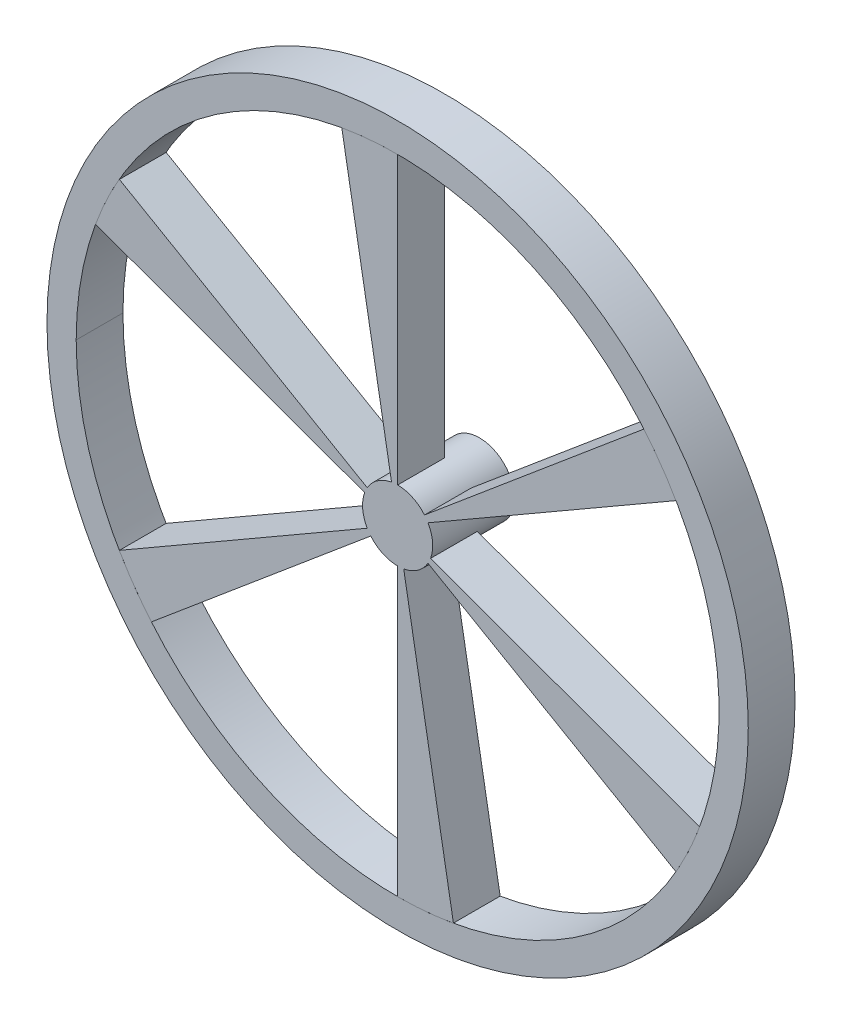
from build123d import *

# Parameters (mm, degrees)
EXTRUDE_8_OUTLINE_R = 300
EXTRUDE_8_DEPTH     = 40
EXTRUDE_START       = 30
SKETCH_2_R          = 30
EXTRUDE_9_DEPTH     = 30


# Read off the part's stored shape, not the designer's step: 凸台-拉伸8
with BuildPart() as part:
    # 凸台-拉伸8 outline → 凸台-拉伸8 (new body)
    # profile 1 of 2: a face of its own
    with BuildSketch(Plane.XY):
        Circle(EXTRUDE_8_OUTLINE_R)
        with BuildLine():
            ThreePointArc((194.455864826, 194.454864826), (275.002, 0), (194.455864826, -194.454864826))
            ThreePointArc((194.455864826, -194.454864826), (-105.237079199, -254.067815398), (-274.998999998, 0))
            ThreePointArc((-274.998999998, 0), (-105.237079199, 254.067815398), (194.455864826, 194.454864826))
        make_face(mode=Mode.SUBTRACT)
    # profile 2 of 2: a face of its own
    with BuildSketch(Plane.XY):
        with BuildLine():
            Line((0.001, 29.999999983), (0.001, 274.999))
            ThreePointArc((0.001, 274.999), (-23.966252232, 273.952592458), (-47.751108002, 270.82133324))
            Line((-47.751108002, 270.82133324), (-5.207505626, 29.544574547))
            ThreePointArc((-5.207505626, 29.544574547), (-17.206076786, 24.575412949), (-25.980262099, 15.000866017))
            Line((-25.980262099, 15.000866017), (-238.154986041, 137.5))
            ThreePointArc((-238.154986041, 137.5), (-249.232369781, 116.220604542), (-258.413031021, 94.056747459))
            Line((-258.413031021, 94.056747459), (-28.190104915, 10.262455111))
            ThreePointArc((-28.190104915, 10.262455111), (-29.885970316, -2.613193121), (-25.981262099, -14.999133966))
            Line((-25.981262099, -14.999133966), (-238.155986034, -137.498267946))
            ThreePointArc((-238.155986034, -137.498267946), (-225.266319296, -157.73136759), (-210.662314239, -176.764099031))
            Line((-210.662314239, -176.764099031), (-22.982599288, -19.282119436))
            ThreePointArc((-22.982599288, -19.282119436), (-12.679893529, -27.188606071), (-0.001, -29.999999983))
            Line((-0.001, -29.999999983), (-0.001, -274.998999993))
            ThreePointArc((-0.001, -274.998999993), (23.966274976, -273.952765434), (47.751168306, -270.821675245))
            Line((47.751168306, -270.821675245), (5.207505626, -29.544574547))
            ThreePointArc((5.207505626, -29.544574547), (17.206076786, -24.575412949), (25.980262099, -15.000866017))
            Line((25.980262099, -15.000866017), (238.156803019, -137.501049033))
            ThreePointArc((238.156803019, -137.501049033), (249.234454424, -116.221567498), (258.415358678, -94.057594657))
            Line((258.415358678, -94.057594657), (28.190104915, -10.262455111))
            ThreePointArc((28.190104915, -10.262455111), (29.885970316, 2.613193121), (25.981262099, 14.999133966))
            Line((25.981262099, 14.999133966), (238.157803028, 137.499316987))
            ThreePointArc((238.157803028, 137.499316987), (225.267868034, 157.732440228), (210.663582322, 176.765163078))
            Line((210.663582322, 176.765163078), (22.982599288, 19.282119436))
            ThreePointArc((22.982599288, 19.282119436), (12.679893529, 27.188606071), (0.001, 29.999999983))
        make_face()
    extrude(amount=EXTRUDE_8_DEPTH)

    # 草图2 → 凸台-拉伸9 (add)
    with BuildSketch(Plane(origin=(0, 0, 0), x_dir=(-1, 0, 0), z_dir=(0, 0, -1)).offset(EXTRUDE_START)):
        Circle(SKETCH_2_R)
    extrude(amount=-EXTRUDE_9_DEPTH)


solid = part.part
